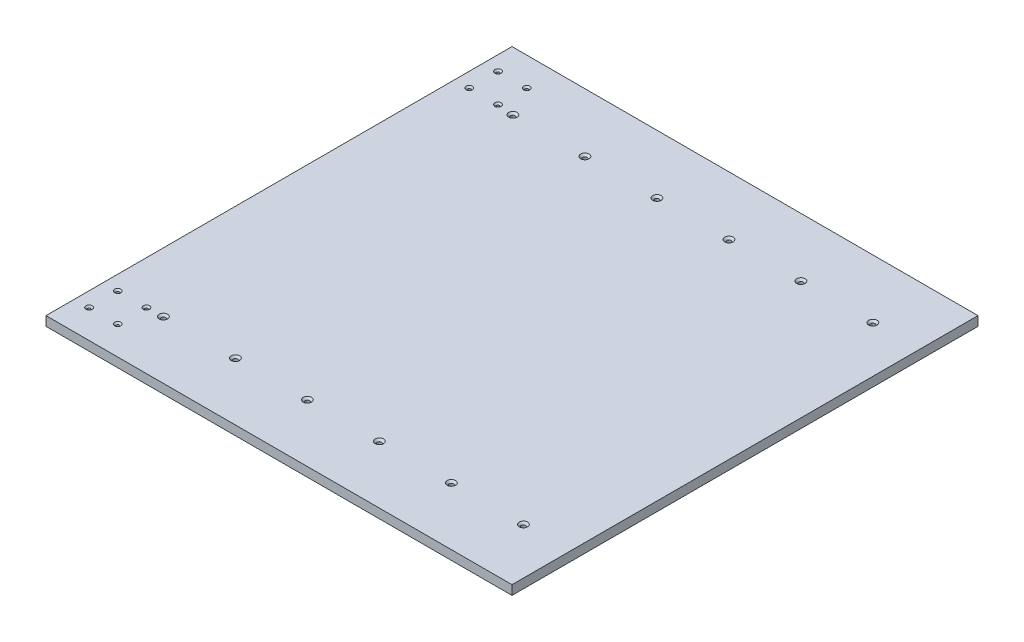
from build123d import *

# Parameters (mm, degrees)
SZKIC1_W                                             = 500
SZKIC1_H                                             = 500
DODANIE_WYCI_GNI_CIE1_DEPTH                          = 10
POG_BIENIE_STO_KOWE_POD_M3_WKR_T_USTALAJ_D           = 3.4
POG_BIENIE_STO_KOWE_POD_M3_WKR_T_USTALAJ_DEPTH       = 10
POG_BIENIE_STO_KOWE_POD_M3_WKR_T_USTALAJ_CSINK_D     = 6.72
POG_BIENIE_STO_KOWE_POD_M3_WKR_T_USTALAJ_CSINK_ANGLE = 90
POG_BIENIE_STO_KOWE_POD_M3_WKR_T_USTALAJ_TIP         = 1.021463052
POG_BIENIE_STO_KOWE_POD_M4_WKR_T_USTALAJ_D           = 4.8
POG_BIENIE_STO_KOWE_POD_M4_WKR_T_USTALAJ_DEPTH       = 11.5
POG_BIENIE_STO_KOWE_POD_M4_WKR_T_USTALAJ_CSINK_D     = 8.96
POG_BIENIE_STO_KOWE_POD_M4_WKR_T_USTALAJ_CSINK_ANGLE = 90
POG_BIENIE_STO_KOWE_POD_M4_WKR_T_USTALAJ_TIP         = 1.442065486


with BuildPart() as part:
    # Szkic1 → Dodanie-wyciągnięcie1 (new body)
    with BuildSketch(Plane(origin=(0, 0, 0), x_dir=(1, 0, 0), z_dir=(0, 1, 0))):
        with Locations((250, 250)):
            Rectangle(SZKIC1_W, SZKIC1_H)
    extrude(amount=DODANIE_WYCI_GNI_CIE1_DEPTH)

    # Pogłębienie stożkowe pod M3 Wkręt ustalający1
    with Locations(Plane(origin=(0, 10, 0), x_dir=(1, 0, 0), z_dir=(0, 1, 0))):
        with Locations((46.4, 30.6), (46.4, 61.4), (15.6, 61.4), (15.6, 30.6), (46.4, 438.6), (46.4, 469.4), (15.6, 469.4), (15.6, 438.6)):
            CounterSinkHole(POG_BIENIE_STO_KOWE_POD_M3_WKR_T_USTALAJ_D / 2, POG_BIENIE_STO_KOWE_POD_M3_WKR_T_USTALAJ_CSINK_D / 2, depth=POG_BIENIE_STO_KOWE_POD_M3_WKR_T_USTALAJ_DEPTH, counter_sink_angle=POG_BIENIE_STO_KOWE_POD_M3_WKR_T_USTALAJ_CSINK_ANGLE)
            with Locations((0, 0, -(POG_BIENIE_STO_KOWE_POD_M3_WKR_T_USTALAJ_DEPTH + POG_BIENIE_STO_KOWE_POD_M3_WKR_T_USTALAJ_TIP / 2))):  # 118° drill point
                Cone(0, POG_BIENIE_STO_KOWE_POD_M3_WKR_T_USTALAJ_D / 2, POG_BIENIE_STO_KOWE_POD_M3_WKR_T_USTALAJ_TIP, mode=Mode.SUBTRACT)

    # Pogłębienie stożkowe pod M4 Wkręt ustalający1
    with Locations(Plane(origin=(0, 10, 0), x_dir=(1, 0, 0), z_dir=(0, 1, 0))):
        with Locations((63.9, 62.07), (141.15, 62.07), (218.4, 62.07), (295.65, 62.07), (372.9, 62.07), (450.15, 62.07), (141.15, 437.07), (218.4, 437.07), (295.65, 437.07), (372.9, 437.07), (450.15, 437.07), (63.9, 437.07)):
            CounterSinkHole(POG_BIENIE_STO_KOWE_POD_M4_WKR_T_USTALAJ_D / 2, POG_BIENIE_STO_KOWE_POD_M4_WKR_T_USTALAJ_CSINK_D / 2, depth=POG_BIENIE_STO_KOWE_POD_M4_WKR_T_USTALAJ_DEPTH, counter_sink_angle=POG_BIENIE_STO_KOWE_POD_M4_WKR_T_USTALAJ_CSINK_ANGLE)
            with Locations((0, 0, -(POG_BIENIE_STO_KOWE_POD_M4_WKR_T_USTALAJ_DEPTH + POG_BIENIE_STO_KOWE_POD_M4_WKR_T_USTALAJ_TIP / 2))):  # 118° drill point
                Cone(0, POG_BIENIE_STO_KOWE_POD_M4_WKR_T_USTALAJ_D / 2, POG_BIENIE_STO_KOWE_POD_M4_WKR_T_USTALAJ_TIP, mode=Mode.SUBTRACT)


solid = part.part
